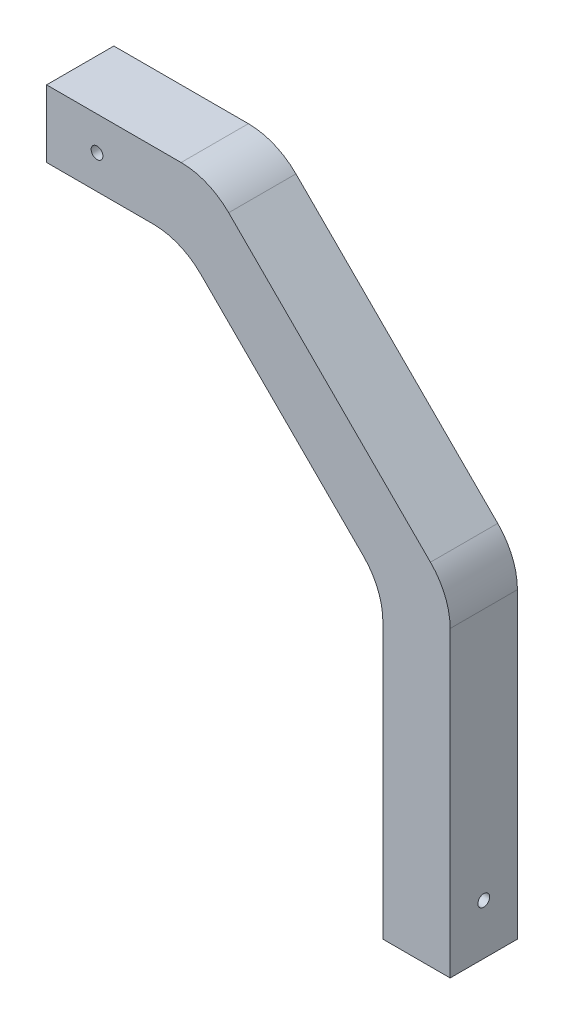
from build123d import *

# Parameters (mm, degrees)
CROQUIS1_R              = 1.75
SALIENTE_EXTRUIR1_DEPTH = 20
REDONDEO1_R             = 20
CROQUIS4_R              = 1.75
CORTAR_EXTRUIR3_DEPTH   = 20


with BuildPart() as part:
    # Croquis1 → Saliente-Extruir1 (new body)
    with BuildSketch(Plane.XY):
        Polygon((-60, 0), (-11.715728753, 0), (60, -71.715728753), (60, -170), (40, -170), (40, -80), (-20, -20), (-60, -20), align=None)
        with Locations((-45, -10)):
            Circle(CROQUIS1_R, mode=Mode.SUBTRACT)
    extrude(amount=SALIENTE_EXTRUIR1_DEPTH)

    # Redondeo1
    redondeo1_edges = [part.edges().sort_by_distance(p)[0] for p in [
        (40, -80, 10),
        (60, -71.715728753, 10),
        (-20, -20, 10),
        (-11.715728753, 0, 10),
    ]]
    fillet(redondeo1_edges, radius=REDONDEO1_R)

    # Croquis4 → Cortar-Extruir3 (cut)
    with BuildSketch(Plane.ZY.offset(-40)):
        with Locations((10, -155)):
            Circle(CROQUIS4_R)
    extrude(amount=-CORTAR_EXTRUIR3_DEPTH, mode=Mode.SUBTRACT)


solid = part.part
